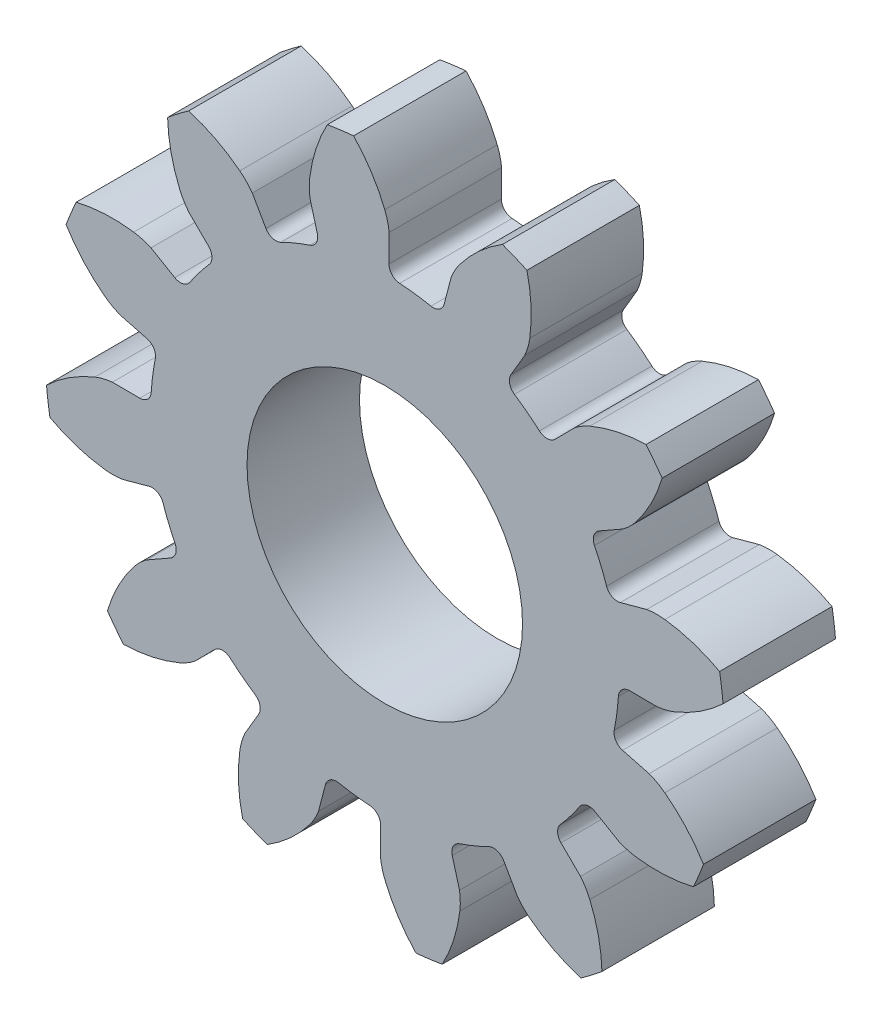
from build123d import *

# Parameters (mm, degrees)
SKETCH1_R           = 2.45
BOSS_EXTRUDE1_DEPTH = 2


with BuildPart() as part:
    # Sketch1 → Boss-Extrude1 (new body)
    with BuildSketch(Plane.XY):
        with BuildLine():
            Line((-1.328942795, 4.660504482), (-1.19987949, 4.189818801))
            ThreePointArc((-1.19987949, 4.189818801), (-1.216390887, 4.041213658), (-1.330404162, 3.944481617))
            ThreePointArc((-1.330404162, 3.944481617), (-1.593034897, 3.845926453), (-1.848431895, 3.729907504))
            ThreePointArc((-1.848431895, 3.729907504), (-1.997451337, 3.717687826), (-2.114206362, 3.81109221))
            Line((-2.114206362, 3.81109221), (-2.35576986, 4.235178785))
            ThreePointArc((-2.35576986, 4.235178785), (-2.458763141, 4.358582017), (-2.578277712, 4.466063368))
            ThreePointArc((-2.578277712, 4.466063368), (-3.011522784, 4.742385054), (-3.488492609, 4.933578024))
            ThreePointArc((-3.488492609, 4.933578024), (-3.678338502, 4.793704066), (-3.862582103, 4.646529059))
            ThreePointArc((-3.862582103, 4.646529059), (-3.80135275, 4.136327205), (-3.646578574, 3.646327286))
            ThreePointArc((-3.646578574, 3.646327286), (-3.573692208, 3.503066854), (-3.481150462, 3.371643878))
            Line((-3.481150462, 3.371643878), (-3.13403552, 3.028549774))
            ThreePointArc((-3.13403552, 3.028549774), (-3.074032238, 2.891598246), (-3.12440461, 2.750819204))
            ThreePointArc((-3.12440461, 2.750819204), (-3.302571916, 2.534152561), (-3.46574273, 2.305978705))
            ThreePointArc((-3.46574273, 2.305978705), (-3.588687514, 2.220886432), (-3.736502523, 2.243399489))
            Line((-3.736502523, 2.243399489), (-4.157745937, 2.489887487))
            ThreePointArc((-4.157745937, 2.489887487), (-4.308642351, 2.545261181), (-4.465885681, 2.578585476))
            ThreePointArc((-4.465885681, 2.578585476), (-4.979247762, 2.601264539), (-5.487912233, 2.528357596))
            ThreePointArc((-5.487912233, 2.528357596), (-5.582386619, 2.312300248), (-5.668358756, 2.092721153))
            ThreePointArc((-5.668358756, 2.092721153), (-5.360231653, 1.681488063), (-4.981193325, 1.334522773))
            ThreePointArc((-4.981193325, 1.334522773), (-4.846441665, 1.246898783), (-4.700586673, 1.17935402))
            Line((-4.700586673, 1.17935402), (-4.228429264, 1.05578328))
            ThreePointArc((-4.228429264, 1.05578328), (-4.107989133, 0.96718142), (-4.081223366, 0.820077007))
            ThreePointArc((-4.081223366, 0.820077007), (-4.127187457, 0.543354537), (-4.1544106, 0.264164774))
            ThreePointArc((-4.1544106, 0.264164774), (-4.218337769, 0.129000312), (-4.357605851, 0.074589687))
            Line((-4.357605851, 0.074589687), (-4.845657348, 0.077432848))
            ThreePointArc((-4.845657348, 0.077432848), (-5.004024322, 0.049939666), (-5.156863188, 0.000177687))
            ThreePointArc((-5.156863188, 0.000177687), (-5.612787323, -0.236862708), (-6.016850205, -0.554334209))
            ThreePointArc((-6.016850205, -0.554334209), (-5.99063875, -0.788682554), (-5.955303257, -1.021829696))
            ThreePointArc((-5.955303257, -1.021829696), (-5.482840813, -1.223904448), (-4.981101347, -1.334866039))
            ThreePointArc((-4.981101347, -1.334866039), (-4.820590991, -1.34337481), (-4.660504482, -1.328942795))
            Line((-4.660504482, -1.328942795), (-4.189818801, -1.19987949))
            ThreePointArc((-4.189818801, -1.19987949), (-4.041213658, -1.216390887), (-3.944481617, -1.330404162))
            ThreePointArc((-3.944481617, -1.330404162), (-3.845926453, -1.593034897), (-3.729907504, -1.848431895))
            ThreePointArc((-3.729907504, -1.848431895), (-3.717687826, -1.997451337), (-3.81109221, -2.114206362))
            Line((-3.81109221, -2.114206362), (-4.235178785, -2.35576986))
            ThreePointArc((-4.235178785, -2.35576986), (-4.358582017, -2.458763141), (-4.466063368, -2.578277712))
            ThreePointArc((-4.466063368, -2.578277712), (-4.742385054, -3.011522784), (-4.933578024, -3.488492609))
            ThreePointArc((-4.933578024, -3.488492609), (-4.793704066, -3.678338502), (-4.646529059, -3.862582103))
            ThreePointArc((-4.646529059, -3.862582103), (-4.136327205, -3.80135275), (-3.646327286, -3.646578574))
            ThreePointArc((-3.646327286, -3.646578574), (-3.503066854, -3.573692208), (-3.371643878, -3.481150462))
            Line((-3.371643878, -3.481150462), (-3.028549774, -3.13403552))
            ThreePointArc((-3.028549774, -3.13403552), (-2.891598246, -3.074032238), (-2.750819204, -3.12440461))
            ThreePointArc((-2.750819204, -3.12440461), (-2.534152561, -3.302571916), (-2.305978705, -3.46574273))
            ThreePointArc((-2.305978705, -3.46574273), (-2.220886432, -3.588687514), (-2.243399489, -3.736502523))
            Line((-2.243399489, -3.736502523), (-2.489887487, -4.157745937))
            ThreePointArc((-2.489887487, -4.157745937), (-2.545261181, -4.308642351), (-2.578585476, -4.465885681))
            ThreePointArc((-2.578585476, -4.465885681), (-2.601264539, -4.979247762), (-2.528357596, -5.487912233))
            ThreePointArc((-2.528357596, -5.487912233), (-2.312300248, -5.582386619), (-2.092721153, -5.668358756))
            ThreePointArc((-2.092721153, -5.668358756), (-1.681488063, -5.360231653), (-1.334522773, -4.981193325))
            ThreePointArc((-1.334522773, -4.981193325), (-1.246898783, -4.846441665), (-1.17935402, -4.700586673))
            Line((-1.17935402, -4.700586673), (-1.05578328, -4.228429264))
            ThreePointArc((-1.05578328, -4.228429264), (-0.96718142, -4.107989133), (-0.820077007, -4.081223366))
            ThreePointArc((-0.820077007, -4.081223366), (-0.543354537, -4.127187457), (-0.264164774, -4.1544106))
            ThreePointArc((-0.264164774, -4.1544106), (-0.129000312, -4.218337769), (-0.074589687, -4.357605851))
            Line((-0.074589687, -4.357605851), (-0.077432848, -4.845657348))
            ThreePointArc((-0.077432848, -4.845657348), (-0.049939666, -5.004024322), (-0.000177687, -5.156863188))
            ThreePointArc((-0.000177687, -5.156863188), (0.236862708, -5.612787323), (0.554334209, -6.016850205))
            ThreePointArc((0.554334209, -6.016850205), (0.788682554, -5.99063875), (1.021829696, -5.955303257))
            ThreePointArc((1.021829696, -5.955303257), (1.223904448, -5.482840813), (1.334866039, -4.981101347))
            ThreePointArc((1.334866039, -4.981101347), (1.34337481, -4.820590991), (1.328942795, -4.660504482))
            Line((1.328942795, -4.660504482), (1.19987949, -4.189818801))
            ThreePointArc((1.19987949, -4.189818801), (1.216390887, -4.041213658), (1.330404162, -3.944481617))
            ThreePointArc((1.330404162, -3.944481617), (1.593034897, -3.845926453), (1.848431895, -3.729907504))
            ThreePointArc((1.848431895, -3.729907504), (1.997451337, -3.717687826), (2.114206362, -3.81109221))
            Line((2.114206362, -3.81109221), (2.35576986, -4.235178785))
            ThreePointArc((2.35576986, -4.235178785), (2.458763141, -4.358582017), (2.578277712, -4.466063368))
            ThreePointArc((2.578277712, -4.466063368), (3.011522784, -4.742385054), (3.488492609, -4.933578024))
            ThreePointArc((3.488492609, -4.933578024), (3.678338502, -4.793704066), (3.862582103, -4.646529059))
            ThreePointArc((3.862582103, -4.646529059), (3.80135275, -4.136327205), (3.646578574, -3.646327286))
            ThreePointArc((3.646578574, -3.646327286), (3.573692208, -3.503066854), (3.481150462, -3.371643878))
            Line((3.481150462, -3.371643878), (3.13403552, -3.028549774))
            ThreePointArc((3.13403552, -3.028549774), (3.074032238, -2.891598246), (3.12440461, -2.750819204))
            ThreePointArc((3.12440461, -2.750819204), (3.302571916, -2.534152561), (3.46574273, -2.305978705))
            ThreePointArc((3.46574273, -2.305978705), (3.588687514, -2.220886432), (3.736502523, -2.243399489))
            Line((3.736502523, -2.243399489), (4.157745937, -2.489887487))
            ThreePointArc((4.157745937, -2.489887487), (4.308642351, -2.545261181), (4.465885681, -2.578585476))
            ThreePointArc((4.465885681, -2.578585476), (4.979247762, -2.601264539), (5.487912233, -2.528357596))
            ThreePointArc((5.487912233, -2.528357596), (5.582386619, -2.312300248), (5.668358756, -2.092721153))
            ThreePointArc((5.668358756, -2.092721153), (5.360231653, -1.681488063), (4.981193325, -1.334522773))
            ThreePointArc((4.981193325, -1.334522773), (4.846441665, -1.246898783), (4.700586673, -1.17935402))
            Line((4.700586673, -1.17935402), (4.228429264, -1.05578328))
            ThreePointArc((4.228429264, -1.05578328), (4.107989133, -0.96718142), (4.081223366, -0.820077007))
            ThreePointArc((4.081223366, -0.820077007), (4.127187457, -0.543354537), (4.1544106, -0.264164774))
            ThreePointArc((4.1544106, -0.264164774), (4.218337769, -0.129000312), (4.357605851, -0.074589687))
            Line((4.357605851, -0.074589687), (4.845657348, -0.077432848))
            ThreePointArc((4.845657348, -0.077432848), (5.004024322, -0.049939666), (5.156863188, -0.000177687))
            ThreePointArc((5.156863188, -0.000177687), (5.612787323, 0.236862708), (6.016850205, 0.554334209))
            ThreePointArc((6.016850205, 0.554334209), (5.99063875, 0.788682554), (5.955303257, 1.021829696))
            ThreePointArc((5.955303257, 1.021829696), (5.482840813, 1.223904448), (4.981101347, 1.334866039))
            ThreePointArc((4.981101347, 1.334866039), (4.820590991, 1.34337481), (4.660504482, 1.328942795))
            Line((4.660504482, 1.328942795), (4.189818801, 1.19987949))
            ThreePointArc((4.189818801, 1.19987949), (4.041213658, 1.216390887), (3.944481617, 1.330404162))
            ThreePointArc((3.944481617, 1.330404162), (3.845926453, 1.593034897), (3.729907504, 1.848431895))
            ThreePointArc((3.729907504, 1.848431895), (3.717687826, 1.997451337), (3.81109221, 2.114206362))
            Line((3.81109221, 2.114206362), (4.235178785, 2.35576986))
            ThreePointArc((4.235178785, 2.35576986), (4.358582017, 2.458763141), (4.466063368, 2.578277712))
            ThreePointArc((4.466063368, 2.578277712), (4.742385054, 3.011522784), (4.933578024, 3.488492609))
            ThreePointArc((4.933578024, 3.488492609), (4.793704066, 3.678338502), (4.646529059, 3.862582103))
            ThreePointArc((4.646529059, 3.862582103), (4.136327205, 3.80135275), (3.646327286, 3.646578574))
            ThreePointArc((3.646327286, 3.646578574), (3.503066854, 3.573692208), (3.371643878, 3.481150462))
            Line((3.371643878, 3.481150462), (3.028549774, 3.13403552))
            ThreePointArc((3.028549774, 3.13403552), (2.891598246, 3.074032238), (2.750819204, 3.12440461))
            ThreePointArc((2.750819204, 3.12440461), (2.534152561, 3.302571916), (2.305978705, 3.46574273))
            ThreePointArc((2.305978705, 3.46574273), (2.220886432, 3.588687514), (2.243399489, 3.736502523))
            Line((2.243399489, 3.736502523), (2.489887487, 4.157745937))
            ThreePointArc((2.489887487, 4.157745937), (2.545261181, 4.308642351), (2.578585476, 4.465885681))
            ThreePointArc((2.578585476, 4.465885681), (2.601264539, 4.979247762), (2.528357596, 5.487912233))
            ThreePointArc((2.528357596, 5.487912233), (2.312300248, 5.582386619), (2.092721153, 5.668358756))
            ThreePointArc((2.092721153, 5.668358756), (1.681488063, 5.360231653), (1.334522773, 4.981193325))
            ThreePointArc((1.334522773, 4.981193325), (1.246898783, 4.846441665), (1.17935402, 4.700586673))
            Line((1.17935402, 4.700586673), (1.05578328, 4.228429264))
            ThreePointArc((1.05578328, 4.228429264), (0.96718142, 4.107989133), (0.820077007, 4.081223366))
            ThreePointArc((0.820077007, 4.081223366), (0.543354537, 4.127187457), (0.264164774, 4.1544106))
            ThreePointArc((0.264164774, 4.1544106), (0.129000312, 4.218337769), (0.074589687, 4.357605851))
            Line((0.074589687, 4.357605851), (0.077432848, 4.845657348))
            ThreePointArc((0.077432848, 4.845657348), (0.049939666, 5.004024322), (0.000177687, 5.156863188))
            ThreePointArc((0.000177687, 5.156863188), (-0.236862708, 5.612787323), (-0.554334209, 6.016850205))
            ThreePointArc((-0.554334209, 6.016850205), (-0.788682554, 5.99063875), (-1.021829696, 5.955303257))
            ThreePointArc((-1.021829696, 5.955303257), (-1.223904448, 5.482840813), (-1.334866039, 4.981101347))
            ThreePointArc((-1.334866039, 4.981101347), (-1.34337481, 4.820590991), (-1.328942795, 4.660504482))
        make_face()
        Circle(SKETCH1_R, mode=Mode.SUBTRACT)
    extrude(amount=BOSS_EXTRUDE1_DEPTH)


solid = part.part
